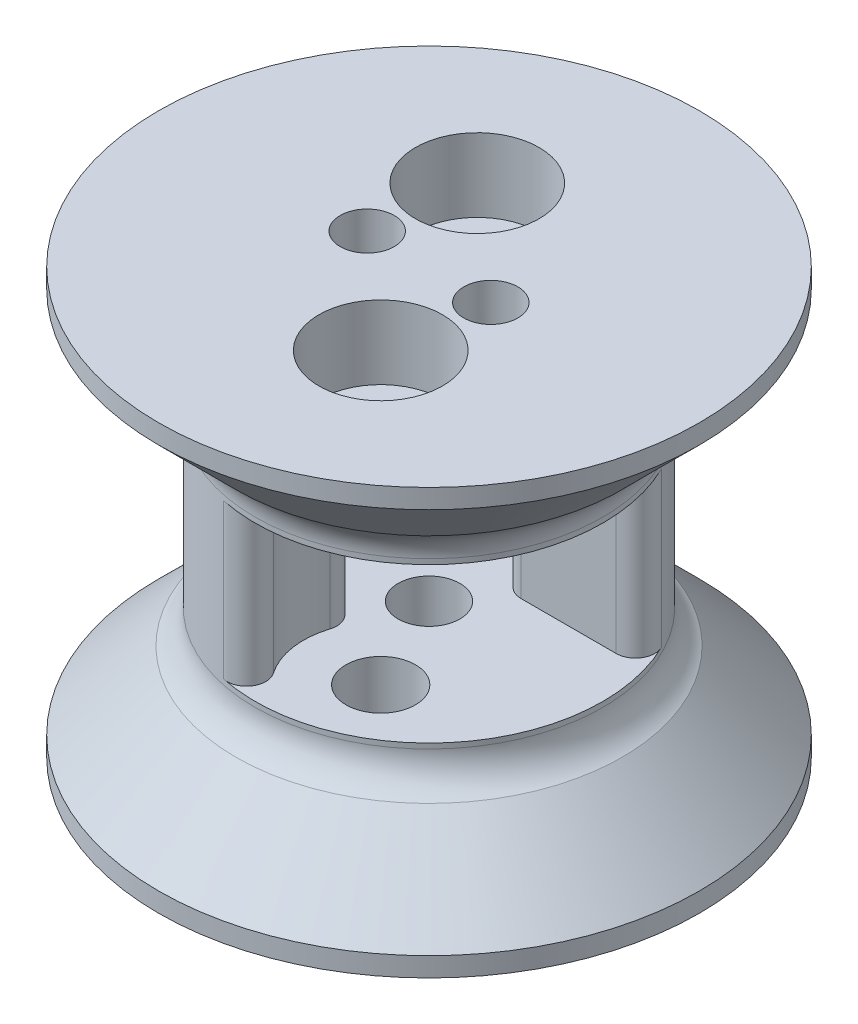
from build123d import *

# Parameters (mm, degrees)
SKETCH1_R               = 11.43
BOSS_EXTRUDE1_DEPTH     = 13.97
CUT_EXTRUDE1_DEPTH      = 5.08
CUT_EXTRUDE2_DEPTH      = 22.364706878
CUT_EXTRUDE2_DEPTH_BACK = 22.364706878
SKETCH3_R               = 2.286
FILLET1_R               = 1.27
SKETCH4_R               = 17.78
SKETCH4_R_2             = 11.43
BOSS_EXTRUDE2_DEPTH     = 6.35
CUT_EXTRUDE3_DEPTH      = 38.588567411
CUT_EXTRUDE3_DEPTH_BACK = 4.826
SKETCH5_R               = 4.064
SKETCH7_R               = 1.778
CUT_EXTRUDE4_DEPTH      = 29.764869198
CHAMFER1_SIZE           = 5.08
FILLET2_R               = 2.54
SKETCH9_R               = 2.032
CUT_EXTRUDE5_DEPTH      = 10.16


with BuildPart() as part:
    # Sketch1 → Boss-Extrude1 (new, symmetric)
    with BuildSketch(Plane(origin=(0, 0, 0), x_dir=(1, 0, 0), z_dir=(0, 1, 0))):
        with Locations(Location((0, 0, 0), (0, 0, 270))):
            Circle(SKETCH1_R)
    extrude(amount=BOSS_EXTRUDE1_DEPTH, both=True)

    # Sketch2 → Cut-Extrude1 (cut, symmetric)
    with BuildSketch(Plane(origin=(0, 0, 0), x_dir=(1, 0, 0), z_dir=(0, 1, 0))):
        with BuildLine():
            Line((10.980176456, 3.175), (0.790573729, 3.175))
            ThreePointArc((0.790573729, 3.175), (1.644174222, 7.956847789), (-1.908379573, 11.269560213))
            ThreePointArc((-1.908379573, 11.269560213), (-9.679362018, 6.079050167), (-10.980176456, -3.175))
            Line((-10.980176456, -3.175), (-0.790573729, -3.175))
            ThreePointArc((-0.790573729, -3.175), (-1.644174222, -7.956847789), (1.908379573, -11.269560213))
            ThreePointArc((1.908379573, -11.269560213), (8.730912854, -7.376724255), (11.43, 0))
            ThreePointArc((11.43, 0), (11.316985396, 1.603353222), (10.980176456, 3.175))
        make_face()
    extrude(amount=CUT_EXTRUDE1_DEPTH, both=True, mode=Mode.SUBTRACT)

    # Sketch3 → Cut-Extrude2 (cut, two sides: drawn at the far end of the back side and taken through both)
    with BuildSketch(Plane(origin=(0, 0, 0), x_dir=(1, 0, 0), z_dir=(0, 1, 0)).offset(-CUT_EXTRUDE2_DEPTH_BACK)):
        with Locations(Location((-3.175, 6.35, 0), (0, 0, 270))):
            Circle(SKETCH3_R)
        with Locations(Location((3.175, -6.35, 0), (0, 0, 270))):
            Circle(SKETCH3_R)
    extrude(amount=CUT_EXTRUDE2_DEPTH + CUT_EXTRUDE2_DEPTH_BACK, mode=Mode.SUBTRACT)

    # Fillet1
    # the kernel refuses this fillet: 1.27 mm, written as the material it takes off along each edge
    with BuildSketch(Plane(origin=(-0.790573729, 5.08, 3.175), x_dir=(-0.4705483235385416, 0, 0.8823742262867087), z_dir=(0, -1, 0))) as fillet1_piece_1:
        with BuildLine():
            CenterArc((2.104974221, 1.248277745), FILLET1_R, 151.930104711, 107.457603124)
            Line((0.984358954, 1.845874115), (0, 0))
            ThreePointArc((0, 0), (0.935544098, 0.086889022), (1.871088197, 0))
        make_face()
    extrude(amount=10.16, mode=Mode.SUBTRACT)
    with BuildSketch(Plane(origin=(-10.980176456, 5.08, 3.175), x_dir=(0.35895527903729396, 0, 0.9333547598053263), z_dir=(0, -1, 0))) as fillet1_piece_2:
        with BuildLine():
            CenterArc((1.847316222, -1.265342552), FILLET1_R, 85.09157022, 115.944479772)
            Line((0.661955677, -1.721215757), (0, 0))
            ThreePointArc((0, 0), (0.977990941, 0.041917031), (1.955981882, 0))
        make_face()
    extrude(amount=10.16, mode=Mode.SUBTRACT)
    with BuildSketch(Plane(origin=(-1.908379573, -5.08, -11.269560213), x_dir=(0.9998377506147018, 0, 0.018013118712026065), z_dir=(0, 1, 0))) as fillet1_piece_3:
        with BuildLine():
            CenterArc((3.987576413, -1.248150652), FILLET1_R, 79.35661856, 136.209501667)
            ThreePointArc((2.954501471, -1.986836082), (1.657014707, -0.726102119), (0, 0))
            ThreePointArc((0, 0), (2.111069866, 0.196644134), (4.222139731, 0))
        make_face()
    extrude(amount=10.16, mode=Mode.SUBTRACT)
    with BuildSketch(Plane(origin=(0.790573729, -5.08, -3.175), x_dir=(1, 0, 0), z_dir=(0, 1, 0))) as fillet1_piece_4:
        with BuildLine():
            CenterArc((2.0919402, 1.27), FILLET1_R, 162.542396876, 107.457603124)
            ThreePointArc((0.880437414, 1.651), (0.516887341, 0.784614516), (0, 0))
            Line((0, 0), (2.0919402, 0))
        make_face()
    extrude(amount=10.16, mode=Mode.SUBTRACT)
    with BuildSketch(Plane(origin=(10.980176456, -5.08, -3.175), x_dir=(-0.3589552790375579, 0, -0.9333547598052248), z_dir=(0, 1, 0))) as fillet1_piece_5:
        with BuildLine():
            CenterArc((1.847316222, 1.265342552), FILLET1_R, 158.963950007, 115.944479772)
            Line((0.661955677, 1.721215757), (0, 0))
            ThreePointArc((0, 0), (0.977990941, -0.041917031), (1.955981882, 0))
        make_face()
    extrude(amount=10.16, mode=Mode.SUBTRACT)
    with BuildSketch(Plane(origin=(1.908379573, 5.08, 11.269560213), x_dir=(-0.9998377506147016, 0, -0.018013118712031834), z_dir=(0, -1, 0))) as fillet1_piece_6:
        with BuildLine():
            CenterArc((3.987576413, 1.248150652), FILLET1_R, 144.433879773, 136.209501667)
            ThreePointArc((2.954501471, 1.986836082), (1.657014707, 0.726102119), (0, 0))
            ThreePointArc((0, 0), (2.111069866, -0.196644134), (4.222139731, 0))
        make_face()
    extrude(amount=10.16, mode=Mode.SUBTRACT)

    # Sketch4 → Boss-Extrude2 (add)
    with BuildSketch(Plane(origin=(0, 13.97, 0), x_dir=(1, 0, 0), z_dir=(0, 1, 0))):
        with Locations(Location((0, 0, 0), (0, 0, 270))):
            Circle(SKETCH4_R)
        with Locations(Location((0, 0, 0), (0, 0, 270))):
            Circle(SKETCH4_R_2, mode=Mode.SUBTRACT)
    boss_extrude2 = extrude(amount=-BOSS_EXTRUDE2_DEPTH)

    # Mirror1: Boss-Extrude2 across plane
    add(boss_extrude2.mirror(Plane.ZX))

    # Sketch5 → Cut-Extrude3 (cut, two sides: drawn at the far end of the back side and taken through both)
    with BuildSketch(Plane(origin=(0, 13.97, 0), x_dir=(1, 0, 0), z_dir=(0, 1, 0)).offset(-CUT_EXTRUDE3_DEPTH_BACK)):
        with Locations(Location((-3.175, 6.35, 0), (0, 0, 90))):
            Circle(SKETCH5_R)
        with Locations(Location((3.175, -6.35, 0), (0, 0, 90))):
            Circle(SKETCH5_R)
    extrude(amount=CUT_EXTRUDE3_DEPTH + CUT_EXTRUDE3_DEPTH_BACK, mode=Mode.SUBTRACT)

    # Sketch7 → Cut-Extrude4 (cut, through all)
    with BuildSketch(Plane(origin=(0, 0, 0), x_dir=(1, 0, 0), z_dir=(0, 1, 0))):
        with Locations(Location((-4.064, 0, 0), (0, 0, 270))):
            Circle(SKETCH7_R)
        with Locations(Location((4.064, 0, 0), (0, 0, 90))):
            Circle(SKETCH7_R)
    extrude(amount=CUT_EXTRUDE4_DEPTH, mode=Mode.SUBTRACT)

    # Chamfer1
    chamfer1_edges = [part.edges().sort_by_distance(p)[0] for p in [
        (0, 7.62, -17.78),
        (0, -7.62, -17.78),
    ]]
    chamfer(chamfer1_edges, length=CHAMFER1_SIZE)

    # Fillet2
    # the kernel refuses this fillet: 2.54 mm, written as the material it adds along each edge
    with BuildSketch(Plane(origin=(0, 7.62, 0), x_dir=(0, 0, 1), z_dir=(-1, 0, 0))) as fillet2_piece_1:
        with BuildLine():
            CenterArc((13.97, -2.199704526), FILLET2_R, 120, 60)
            Line((12.7, 0), (12.6746, 0.043994091))
            ThreePointArc((12.6746, 0.043994091), (12.065, 0.0508), (11.43, 0.0508))
            Line((11.43, 0.0508), (11.3792, 0))
            Line((11.3792, 0), (11.3792, -2.199704526))
            Line((11.3792, -2.199704526), (11.43, -2.199704526))
        make_face()
    revolve(axis=Axis((0, 7.62, 0), (0, 1, 0)))
    with BuildSketch(Plane(origin=(0, -7.62, 0), x_dir=(0, 0, 1), z_dir=(-1, 0, 0))) as fillet2_piece_2:
        with BuildLine():
            CenterArc((13.97, 2.199704526), FILLET2_R, 180, 60)
            Line((11.43, 2.199704526), (11.3792, 2.199704526))
            Line((11.3792, 2.199704526), (11.3792, 0))
            Line((11.3792, 0), (11.43, -0.0508))
            ThreePointArc((11.43, -0.0508), (12.065, -0.0508), (12.6746, -0.043994091))
            Line((12.6746, -0.043994091), (12.7, 0))
        make_face()
    revolve(axis=Axis((0, -7.62, 0), (0, 1, 0)))

    # Sketch9 → Cut-Extrude5 (cut)
    with BuildSketch(Plane.XZ.offset(13.97)):
        with Locations(Location((0, 0, 0), (0, 0, 270))):
            Circle(SKETCH9_R)
    extrude(amount=-CUT_EXTRUDE5_DEPTH, mode=Mode.SUBTRACT)


solid = part.part
